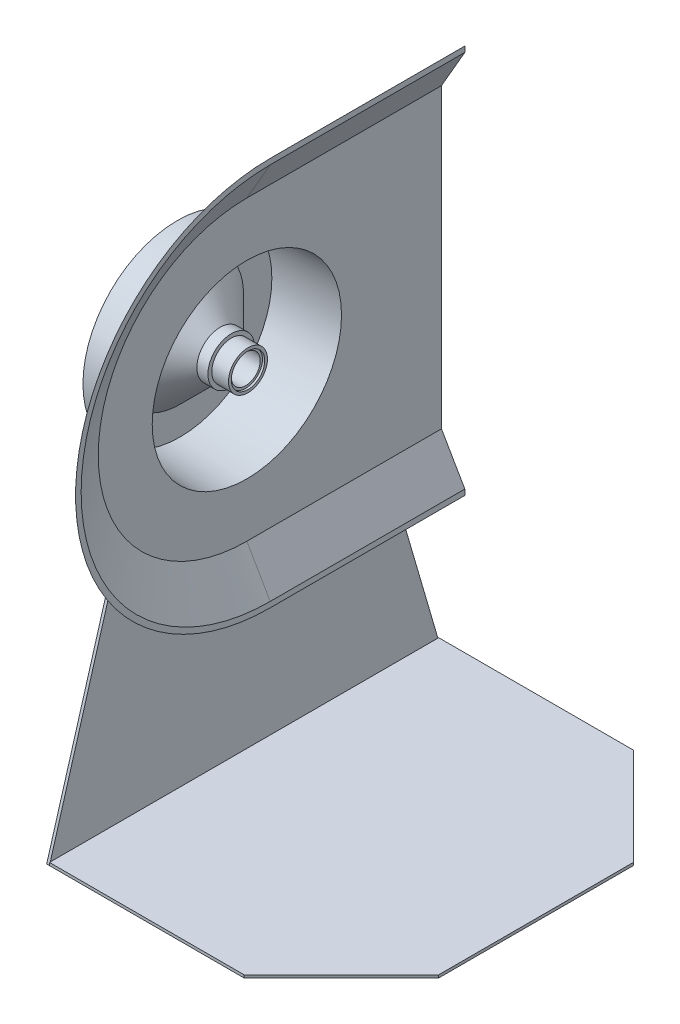
from build123d import *
from build123d.topology import SkipClean

# Parameters (mm, degrees)
REVOLVE1_ANGLE          = 180
SKETCH12_R              = 175
BOSS_EXTRUDE2_DEPTH     = 120
BOSS_EXTRUDE2_TAPER     = 2.5
BOSS_EXTRUDE3_DEPTH     = 350
SKETCH14_R              = 112
CUT_EXTRUDE1_DEPTH      = 32
CUT_EXTRUDE1_DRAFT      = -45
SKETCH17_R              = 31
CUT_EXTRUDE3_DEPTH      = 6
SHELL1_T                = -5
SKETCH15_R              = 26
CUT_EXTRUDE2_DEPTH      = 514.054577993
BOSS_EXTRUDE4_DEPTH     = 5
BOSS_EXTRUDE5_DEPTH     = 5
ENL_V_MAT_EXTRU_2_REACH = 924.469


with BuildPart() as part:
    # Esquisse2 → Revolve1 (revolve)
    with BuildSketch(Plane.XY):
        Polygon((0, 350), (0, 0), (-47, 0), (-47, 268.593612044), align=None)
    revolve(axis=Axis((-47, 0, 0), (1, 0, 0)), revolution_arc=REVOLVE1_ANGLE)

    # Sketch12 → Boss-Extrude2 (add)
    with BuildSketch(Plane.ZY.offset(47)):
        Circle(SKETCH12_R)
    extrude(amount=BOSS_EXTRUDE2_DEPTH, taper=BOSS_EXTRUDE2_TAPER)

    # Sketch13 → Boss-Extrude3 (add)
    with BuildSketch(Plane(origin=(0, 0, 0), x_dir=(-1, 0, 0), z_dir=(0, 0, -1))):
        Polygon((0, 350), (47, 268.593612044), (47, -268.593612044), (0, -350), align=None)
    extrude(amount=BOSS_EXTRUDE3_DEPTH)


with BuildPart() as cut_extrude1_tool:
    # Sketch14 → Cut-Extrude1 (with draft: the straight prism first)
    with BuildSketch(Plane.ZY.offset(167)):
        Circle(SKETCH14_R)
    extrude(amount=-CUT_EXTRUDE1_DEPTH)
    # Cut-Extrude1: the draft: its side faces are tilted about the plane it starts from
    cut_extrude1_sides = [cut_extrude1_tool.faces().sort_by_distance(p)[0] for p in [
        (-151, 0, -112),
    ]]
    draft(cut_extrude1_sides, Plane.ZY.offset(167), CUT_EXTRUDE1_DRAFT)


with BuildPart() as part_1:
    add(part.part)

    # Cut-Extrude1: cut by cut_extrude1_tool
    add(cut_extrude1_tool.part, mode=Mode.SUBTRACT)

    # Sketch17 → Cut-Extrude3 (cut)
    with BuildSketch(Plane.ZY.offset(135)):
        Circle(SKETCH17_R)
    extrude(amount=-CUT_EXTRUDE3_DEPTH, mode=Mode.SUBTRACT)

    # Shell1
    shell1_openings = [part_1.faces().sort_by_distance(p)[0] for p in [
        (-22.469140062, 0, -350),
        (0, 0, -32.672450622),
    ]]
    offset(amount=SHELL1_T, openings=shell1_openings, kind=Kind.INTERSECTION)

    # Sketch15 → Cut-Extrude2 (cut, through all)
    with BuildSketch(Plane.ZY.offset(135)):
        Circle(SKETCH15_R)
    extrude(amount=-CUT_EXTRUDE2_DEPTH, mode=Mode.SUBTRACT)

    # Sketch18 → Revolve2 (revolve)
    with SkipClean():  # the faces are left unmerged after this step: merging them gives an invalid solid
        with BuildSketch(Plane.XY):
            Polygon((-130, 82.071067812), (-89.928932188, 42), (-70, 42), (-70, 35.049253939), (-40, 35.049253939), (-40, 30.094402667), (-44, 30.094402667), (-44, 26), (-124, 26), (-124, 36), (-130, 36), align=None)
        revolve(axis=Axis((0, 0, 0), (-1, 0, 0)))

    # Sketch20 → Boss-Extrude4 (add)
    with SkipClean():  # the faces are left unmerged after this step: merging them gives an invalid solid
        with BuildSketch(Plane.ZY.offset(47)):
            with BuildLine():
                Line((-350, -600), (350, -600))
                Line((350, -600), (175, 0))
                ThreePointArc((175, 0), (0, -175), (-175, 0))
                Line((-175, 0), (-350, -600))
            make_face()
        extrude(amount=BOSS_EXTRUDE4_DEPTH)

    # Sketch21 → Boss-Extrude5 (add)
    with SkipClean():  # the faces are left unmerged after this step: merging them gives an invalid solid
        with BuildSketch(Plane.XZ.offset(600)):
            Polygon((-47, 350), (-47, -350), (303, -350), (478, -175), (478, 175), (303, 350), align=None)
        extrude(amount=-BOSS_EXTRUDE5_DEPTH)

    # Esquisse3 → Enlèv. mat.-Extru.2 (cut, up to next)
    with BuildSketch(Plane.ZY.offset(129), mode=Mode.PRIVATE) as enl_v_mat_extru_2_sk1:
        Polygon((-4, 30), (4, 30), (4, 26), (4, 25), (-4, 25), (-4, 26), align=None)
    enl_v_mat_extru_2_tool1 = extrude(enl_v_mat_extru_2_sk1.sketch, amount=-ENL_V_MAT_EXTRU_2_REACH, mode=Mode.PRIVATE) & part_1.part
    add(enl_v_mat_extru_2_tool1.solids().sort_by_distance((-129, 27.5, 0))[0], mode=Mode.SUBTRACT)


solid = part_1.part
